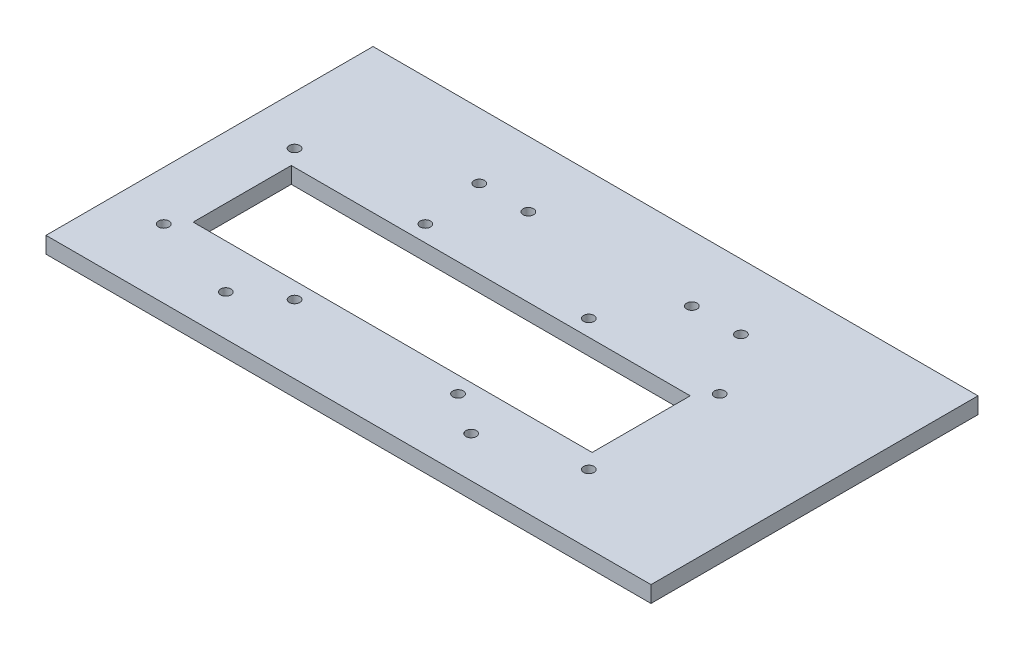
from build123d import *

# Parameters (mm, degrees)
SKETCH1_W           = 185
SKETCH1_H           = 100
SKETCH1_W_2         = 122
SKETCH1_H_2         = 30
BOSS_EXTRUDE1_DEPTH = 5
CUT_EXTRUDE2_REACH  = 122.545
SKETCH2_R           = 1.6
CUT_EXTRUDE3_REACH  = 122.545
SKETCH3_R           = 1.6
CUT_EXTRUDE4_REACH  = 122.545
SKETCH4_R           = 1.6


with BuildPart() as part:
    # Sketch1 → Boss-Extrude1 (new body)
    with BuildSketch(Plane(origin=(0, 0, 0), x_dir=(1, 0, 0), z_dir=(0, 1, 0))):
        with Locations((12.5, 9)):
            Rectangle(SKETCH1_W, SKETCH1_H)
        Rectangle(SKETCH1_W_2, SKETCH1_H_2, mode=Mode.SUBTRACT)
    extrude(amount=BOSS_EXTRUDE1_DEPTH)

    # Sketch2 → Cut-Extrude2 (cut, up to next)
    with BuildSketch(Plane(origin=(0, 0, 0), x_dir=(1, 0, 0), z_dir=(0, 1, 0)), mode=Mode.PRIVATE) as cut_extrude2_sk1:
        with Locations((-25, 20)):
            Circle(SKETCH2_R)
    cut_extrude2_tool1 = extrude(cut_extrude2_sk1.sketch, amount=CUT_EXTRUDE2_REACH, mode=Mode.PRIVATE) & part.part
    # Sketch2 → Cut-Extrude2 (cut, up to next)
    with BuildSketch(Plane(origin=(0, 0, 0), x_dir=(1, 0, 0), z_dir=(0, 1, 0)), mode=Mode.PRIVATE) as cut_extrude2_sk2:
        with Locations((25, 20)):
            Circle(SKETCH2_R)
    cut_extrude2_tool2 = extrude(cut_extrude2_sk2.sketch, amount=CUT_EXTRUDE2_REACH, mode=Mode.PRIVATE) & part.part
    # Sketch2 → Cut-Extrude2 (cut, up to next)
    with BuildSketch(Plane(origin=(0, 0, 0), x_dir=(1, 0, 0), z_dir=(0, 1, 0)), mode=Mode.PRIVATE) as cut_extrude2_sk3:
        with Locations((25, -20)):
            Circle(SKETCH2_R)
    cut_extrude2_tool3 = extrude(cut_extrude2_sk3.sketch, amount=CUT_EXTRUDE2_REACH, mode=Mode.PRIVATE) & part.part
    # Sketch2 → Cut-Extrude2 (cut, up to next)
    with BuildSketch(Plane(origin=(0, 0, 0), x_dir=(1, 0, 0), z_dir=(0, 1, 0)), mode=Mode.PRIVATE) as cut_extrude2_sk4:
        with Locations((-25, -20)):
            Circle(SKETCH2_R)
    cut_extrude2_tool4 = extrude(cut_extrude2_sk4.sketch, amount=CUT_EXTRUDE2_REACH, mode=Mode.PRIVATE) & part.part
    # Sketch2 → Cut-Extrude2 (cut, up to next)
    with BuildSketch(Plane(origin=(0, 0, 0), x_dir=(1, 0, 0), z_dir=(0, 1, 0)), mode=Mode.PRIVATE) as cut_extrude2_sk5:
        with Locations((-65, 20)):
            Circle(SKETCH2_R)
    cut_extrude2_tool5 = extrude(cut_extrude2_sk5.sketch, amount=CUT_EXTRUDE2_REACH, mode=Mode.PRIVATE) & part.part
    # Sketch2 → Cut-Extrude2 (cut, up to next)
    with BuildSketch(Plane(origin=(0, 0, 0), x_dir=(1, 0, 0), z_dir=(0, 1, 0)), mode=Mode.PRIVATE) as cut_extrude2_sk6:
        with Locations((65, 20)):
            Circle(SKETCH2_R)
    cut_extrude2_tool6 = extrude(cut_extrude2_sk6.sketch, amount=CUT_EXTRUDE2_REACH, mode=Mode.PRIVATE) & part.part
    # Sketch2 → Cut-Extrude2 (cut, up to next)
    with BuildSketch(Plane(origin=(0, 0, 0), x_dir=(1, 0, 0), z_dir=(0, 1, 0)), mode=Mode.PRIVATE) as cut_extrude2_sk7:
        with Locations((65, -20)):
            Circle(SKETCH2_R)
    cut_extrude2_tool7 = extrude(cut_extrude2_sk7.sketch, amount=CUT_EXTRUDE2_REACH, mode=Mode.PRIVATE) & part.part
    # Sketch2 → Cut-Extrude2 (cut, up to next)
    with BuildSketch(Plane(origin=(0, 0, 0), x_dir=(1, 0, 0), z_dir=(0, 1, 0)), mode=Mode.PRIVATE) as cut_extrude2_sk8:
        with Locations((-65, -20)):
            Circle(SKETCH2_R)
    cut_extrude2_tool8 = extrude(cut_extrude2_sk8.sketch, amount=CUT_EXTRUDE2_REACH, mode=Mode.PRIVATE) & part.part
    add(cut_extrude2_tool1.solids().sort_by_distance((-25, 0, -20))[0], mode=Mode.SUBTRACT)
    add(cut_extrude2_tool2.solids().sort_by_distance((25, 0, -20))[0], mode=Mode.SUBTRACT)
    add(cut_extrude2_tool3.solids().sort_by_distance((25, 0, 20))[0], mode=Mode.SUBTRACT)
    add(cut_extrude2_tool4.solids().sort_by_distance((-25, 0, 20))[0], mode=Mode.SUBTRACT)
    add(cut_extrude2_tool5.solids().sort_by_distance((-65, 0, -20))[0], mode=Mode.SUBTRACT)
    add(cut_extrude2_tool6.solids().sort_by_distance((65, 0, -20))[0], mode=Mode.SUBTRACT)
    add(cut_extrude2_tool7.solids().sort_by_distance((65, 0, 20))[0], mode=Mode.SUBTRACT)
    add(cut_extrude2_tool8.solids().sort_by_distance((-65, 0, 20))[0], mode=Mode.SUBTRACT)

    # Sketch3 → Cut-Extrude3 (cut, up to next)
    with BuildSketch(Plane(origin=(0, 5, 0), x_dir=(1, 0, 0), z_dir=(0, 1, 0)), mode=Mode.PRIVATE) as cut_extrude3_sk1:
        with Locations((-27.5, 39)):
            Circle(SKETCH3_R)
    cut_extrude3_tool1 = extrude(cut_extrude3_sk1.sketch, amount=-CUT_EXTRUDE3_REACH, mode=Mode.PRIVATE) & part.part
    # Sketch3 → Cut-Extrude3 (cut, up to next)
    with BuildSketch(Plane(origin=(0, 5, 0), x_dir=(1, 0, 0), z_dir=(0, 1, 0)), mode=Mode.PRIVATE) as cut_extrude3_sk2:
        with Locations((-12.5, 39)):
            Circle(SKETCH3_R)
    cut_extrude3_tool2 = extrude(cut_extrude3_sk2.sketch, amount=-CUT_EXTRUDE3_REACH, mode=Mode.PRIVATE) & part.part
    # Sketch3 → Cut-Extrude3 (cut, up to next)
    with BuildSketch(Plane(origin=(0, 5, 0), x_dir=(1, 0, 0), z_dir=(0, 1, 0)), mode=Mode.PRIVATE) as cut_extrude3_sk3:
        with Locations((37.5, 39)):
            Circle(SKETCH3_R)
    cut_extrude3_tool3 = extrude(cut_extrude3_sk3.sketch, amount=-CUT_EXTRUDE3_REACH, mode=Mode.PRIVATE) & part.part
    # Sketch3 → Cut-Extrude3 (cut, up to next)
    with BuildSketch(Plane(origin=(0, 5, 0), x_dir=(1, 0, 0), z_dir=(0, 1, 0)), mode=Mode.PRIVATE) as cut_extrude3_sk4:
        with Locations((52.5, 39)):
            Circle(SKETCH3_R)
    cut_extrude3_tool4 = extrude(cut_extrude3_sk4.sketch, amount=-CUT_EXTRUDE3_REACH, mode=Mode.PRIVATE) & part.part
    add(cut_extrude3_tool1.solids().sort_by_distance((-27.5, 5, -39))[0], mode=Mode.SUBTRACT)
    add(cut_extrude3_tool2.solids().sort_by_distance((-12.5, 5, -39))[0], mode=Mode.SUBTRACT)
    add(cut_extrude3_tool3.solids().sort_by_distance((37.5, 5, -39))[0], mode=Mode.SUBTRACT)
    add(cut_extrude3_tool4.solids().sort_by_distance((52.5, 5, -39))[0], mode=Mode.SUBTRACT)

    # Sketch4 → Cut-Extrude4 (cut, up to next)
    with BuildSketch(Plane(origin=(0, 5, 0), x_dir=(1, 0, 0), z_dir=(0, 1, 0)), mode=Mode.PRIVATE) as cut_extrude4_sk1:
        with Locations((-37.5, -28.5)):
            Circle(SKETCH4_R)
    cut_extrude4_tool1 = extrude(cut_extrude4_sk1.sketch, amount=-CUT_EXTRUDE4_REACH, mode=Mode.PRIVATE) & part.part
    # Sketch4 → Cut-Extrude4 (cut, up to next)
    with BuildSketch(Plane(origin=(0, 5, 0), x_dir=(1, 0, 0), z_dir=(0, 1, 0)), mode=Mode.PRIVATE) as cut_extrude4_sk2:
        with Locations((37.5, -28.5)):
            Circle(SKETCH4_R)
    cut_extrude4_tool2 = extrude(cut_extrude4_sk2.sketch, amount=-CUT_EXTRUDE4_REACH, mode=Mode.PRIVATE) & part.part
    add(cut_extrude4_tool1.solids().sort_by_distance((-37.5, 5, 28.5))[0], mode=Mode.SUBTRACT)
    add(cut_extrude4_tool2.solids().sort_by_distance((37.5, 5, 28.5))[0], mode=Mode.SUBTRACT)


solid = part.part
